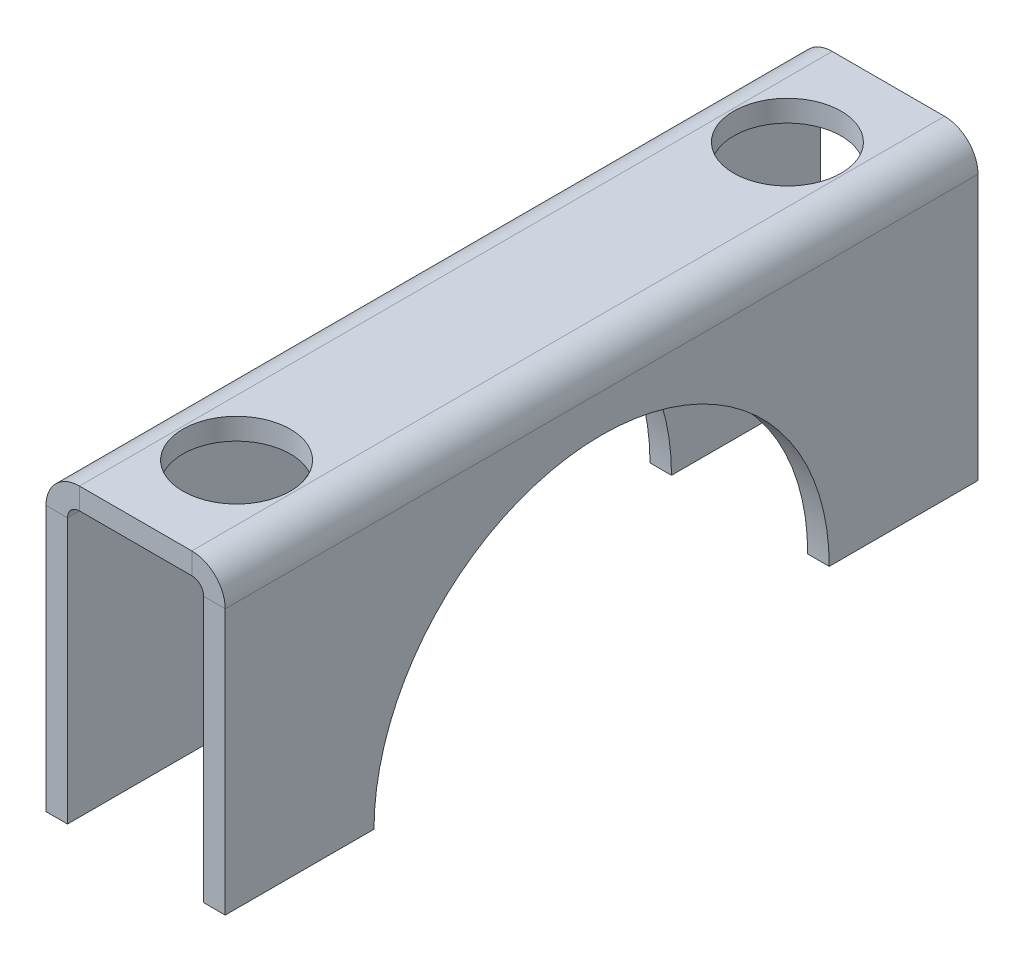
from build123d import *

# Parameters (mm, degrees)
FLANGE_BASE1_DEPTH    = 63
ESBO_O6_R             = 19.05
CORTE_EXTRUS_O1_DEPTH = 20
CORTE_EXTRUS_O2_REACH = 71.419
ESBO_O7_R             = 4.5


# Sheet-metal steps are written as plain solids
with BuildPart() as part:
    # Esboço1 → Flange-base1 (new body)
    with BuildSketch(Plane.XY):
        with BuildLine():
            Line((0, 0), (0, 22.2))
            ThreePointArc((0, 22.2), (0.820101013, 24.179898987), (2.8, 25))
            Line((2.8, 25), (12.2, 25))
            ThreePointArc((12.2, 25), (14.179898987, 24.179898987), (15, 22.2))
            Line((15, 22.2), (15, 0))
            Line((15, 0), (13.2, 0))
            Line((13.2, 0), (13.2, 22.2))
            ThreePointArc((13.2, 22.2), (12.907106781, 22.907106781), (12.2, 23.2))
            Line((12.2, 23.2), (2.8, 23.2))
            ThreePointArc((2.8, 23.2), (2.092893219, 22.907106781), (1.8, 22.2))
            Line((1.8, 22.2), (1.8, 0))
            Line((1.8, 0), (0, 0))
        make_face()
    extrude(amount=FLANGE_BASE1_DEPTH)

    # Esboço6 → Corte-extrusão1 (cut)
    with BuildSketch(Plane(origin=(15, 0, 0), x_dir=(0, 0, -1), z_dir=(1, 0, 0))):
        with Locations((-31.5, 0)):
            Circle(ESBO_O6_R)
    extrude(amount=-CORTE_EXTRUS_O1_DEPTH, mode=Mode.SUBTRACT)

    # Esboço7 → Corte-extrusão2 (cut, up to next)
    with BuildSketch(Plane(origin=(0, 25, 0), x_dir=(1, 0, 0), z_dir=(0, 1, 0)), mode=Mode.PRIVATE) as corte_extrus_o2_sk1:
        with Locations(Location((7.5, -54.55, 0), (0, 0, 270))):
            Circle(ESBO_O7_R)
    corte_extrus_o2_tool1 = extrude(corte_extrus_o2_sk1.sketch, amount=-CORTE_EXTRUS_O2_REACH, mode=Mode.PRIVATE) & part.part
    # Esboço7 → Corte-extrusão2 (cut, up to next)
    with BuildSketch(Plane(origin=(0, 25, 0), x_dir=(1, 0, 0), z_dir=(0, 1, 0)), mode=Mode.PRIVATE) as corte_extrus_o2_sk2:
        with Locations(Location((7.5, -8.45, 0), (0, 0, 270))):
            Circle(ESBO_O7_R)
    corte_extrus_o2_tool2 = extrude(corte_extrus_o2_sk2.sketch, amount=-CORTE_EXTRUS_O2_REACH, mode=Mode.PRIVATE) & part.part
    add(corte_extrus_o2_tool1.solids().sort_by_distance((7.5, 25, 54.55))[0], mode=Mode.SUBTRACT)
    add(corte_extrus_o2_tool2.solids().sort_by_distance((7.5, 25, 8.45))[0], mode=Mode.SUBTRACT)


solid = part.part
